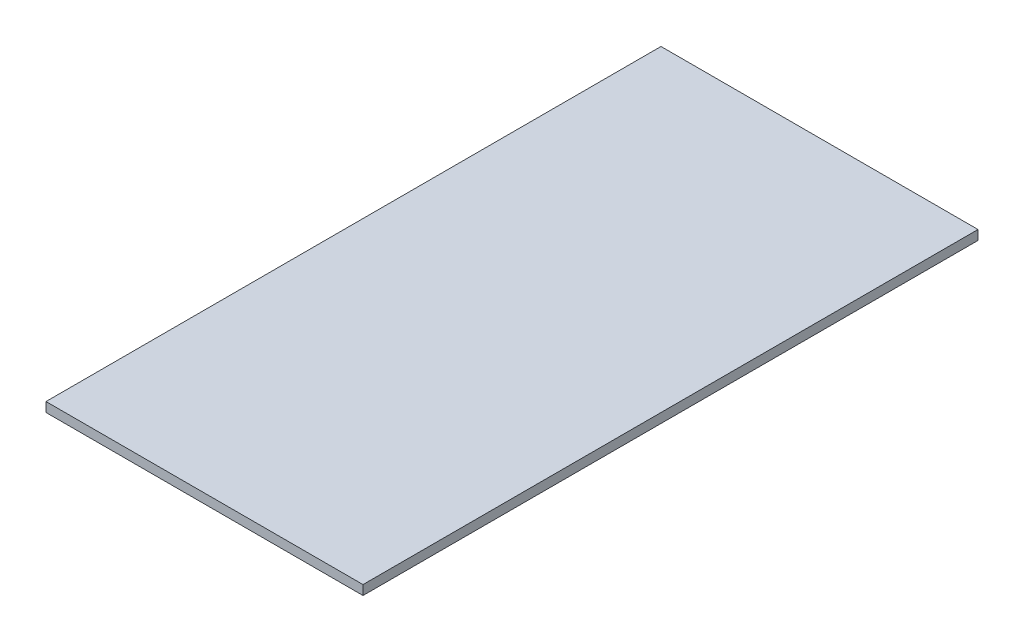
from build123d import *

# Parameters (mm, degrees)
SKETCH1_W           = 63.5
SKETCH1_H           = 123.19
BOSS_EXTRUDE1_DEPTH = 1.905


with BuildPart() as part:
    # Sketch1 → Boss-Extrude1 (new body)
    with BuildSketch(Plane(origin=(0, 0, 0), x_dir=(1, 0, 0), z_dir=(0, 1, 0))):
        with Locations((31.75, 61.595)):
            Rectangle(SKETCH1_W, SKETCH1_H)
    extrude(amount=BOSS_EXTRUDE1_DEPTH)


solid = part.part
